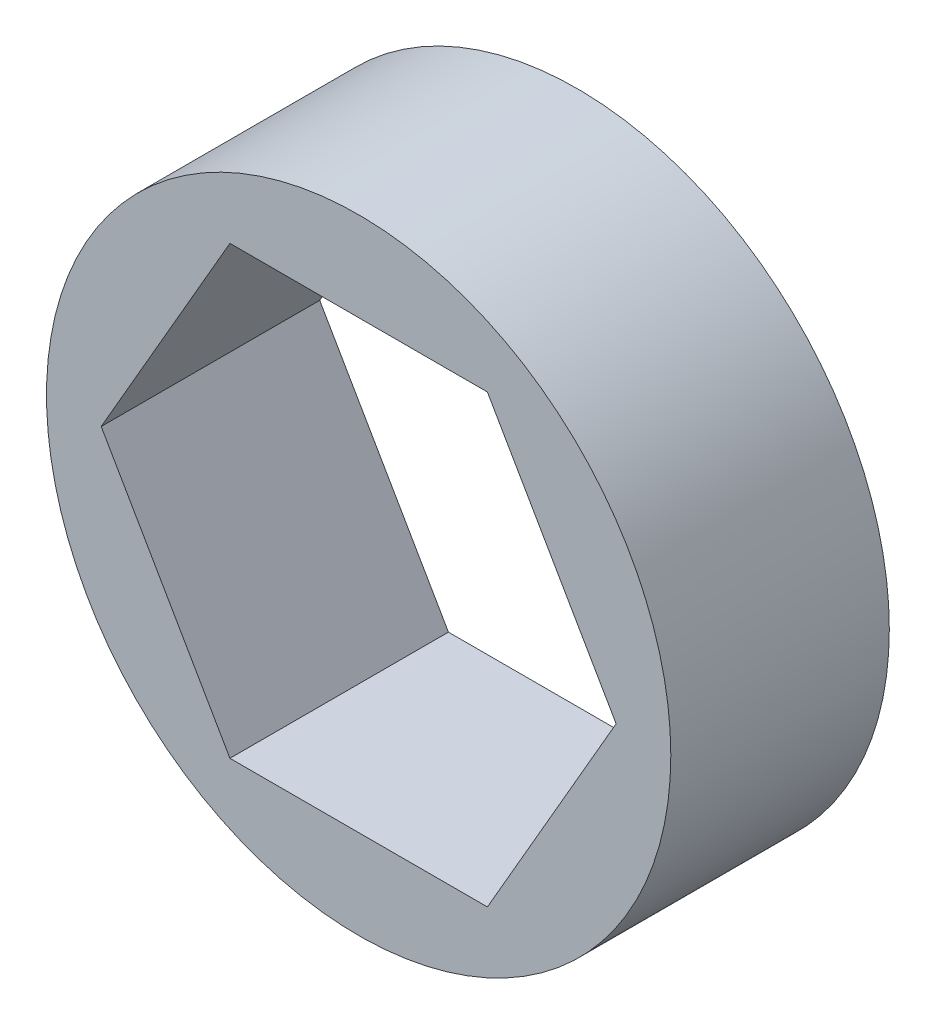
from build123d import *

# Parameters (mm, degrees)
SKETCH1_R           = 8.89
BOSS_EXTRUDE1_DEPTH = 3.1115


with BuildPart() as part:
    # Sketch1 → Boss-Extrude1 (new, symmetric)
    with BuildSketch(Plane.XY):
        Circle(SKETCH1_R)
        Polygon((-7.332348419, 0), (-3.666174209, -6.35), (3.666174209, -6.35), (7.332348419, 0), (3.666174209, 6.35), (-3.666174209, 6.35), align=None, mode=Mode.SUBTRACT)
    extrude(amount=BOSS_EXTRUDE1_DEPTH, both=True)


solid = part.part
